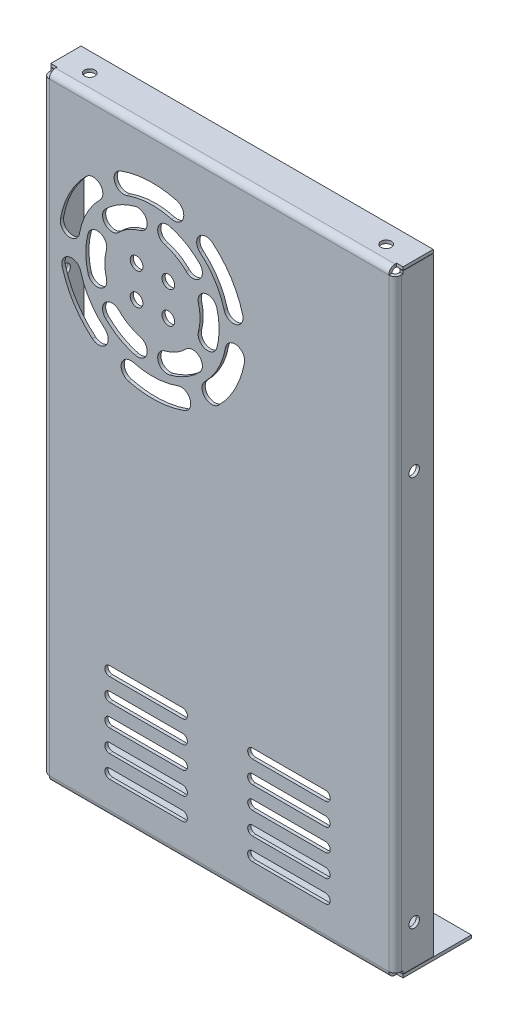
from build123d import *

# Parameters (mm, degrees)
SKETCH1_W                 = 110.95
SKETCH1_H                 = 194
EXTRUDE1_DEPTH            = 24
SHELL1_T                  = -1
SHEET_START               = -89
SHEET_METAL_1_DEPTH       = 195
SHEET_METAL_1_2_DEPTH     = 2.5
SHEET_START_2             = 103.5
SHEET_METAL_1_3_DEPTH     = 2.5
SHEET_START_3             = -87.5
SHEET_METAL_1_4_OUTLINE_W = 1
SHEET_METAL_1_4_OUTLINE_H = 21.509801
SHEET_METAL_1_4_DEPTH     = 0.1
SHEET_START_4             = 104.4
SHEET_METAL_1_5_OUTLINE_W = 1
SHEET_METAL_1_5_OUTLINE_H = 21.509801
SHEET_METAL_1_5_DEPTH     = 0.1
SHEET_START_5             = -86.5
SHEET_METAL_1_6_DEPTH     = 190
SHEET_START_6             = -53.45
SHEET_METAL_1_7_DEPTH     = 106.95
SHEET_METAL_1_8_DEPTH     = 106.95
SKETCH6_W                 = 110.95
SKETCH6_H                 = 192.9
CUT_EXTRUDE1_DEPTH        = 12
CUT_EXTRUDE2_DEPTH        = 2
LPATTERN1_COUNT           = 5
LPATTERN1_PITCH           = 7
LPATTERN1_COUNT_DIR2      = 2
LPATTERN1_PITCH_DIR2      = 45
SKETCH8_R                 = 2
CUT_EXTRUDE3_DEPTH        = 2
SKETCH11_R                = 1.65
CUT_EXTRUDE4_DEPTH        = 157.445677473
SKETCH15_R                = 1.65
CUT_EXTRUDE5_DEPTH        = 1


with BuildPart() as part:
    # Sketch1 → Extrude1 (new body)
    with BuildSketch(Plane.XY):
        with Locations((0.025, 8.5)):
            Rectangle(SKETCH1_W, SKETCH1_H)
    extrude(amount=-EXTRUDE1_DEPTH)

    # Shell1
    shell1_openings = [part.faces().sort_by_distance(p)[0] for p in [
        (0.025, 8.5, -24),
    ]]
    offset(amount=SHELL1_T, openings=shell1_openings, kind=Kind.INTERSECTION)

    # Sheet Metal 1: read off the stored shape, not the designer's step
    # Sheet Metal 1 outline → Sheet Metal 1 (cut)
    with BuildSketch(Plane(origin=(0, 0, 0), x_dir=(1, 0, 0), z_dir=(0, 1, 0)).offset(SHEET_START)):
        with BuildLine():
            Line((-55.45, 0), (-53.45, 0))
            ThreePointArc((-53.45, 0), (-54.864213562, 0.585786438), (-55.45, 2))
            Line((-55.45, 2), (-55.45, 0))
        make_face()
        with BuildLine():
            ThreePointArc((-54.45, 2), (-54.157106781, 1.292893219), (-53.45, 1))
            Line((-53.45, 1), (-53.45, 2.490199))
            Line((-53.45, 2.490199), (-54.45, 2.490199))
            Line((-54.45, 2.490199), (-54.45, 2))
        make_face()
        with BuildLine():
            ThreePointArc((55.5, 2), (54.914213562, 0.585786438), (53.5, 0))
            Line((53.5, 0), (55.5, 0))
            Line((55.5, 0), (55.5, 2))
        make_face()
        with BuildLine():
            Line((53.5, 2.490199), (53.5, 1))
            ThreePointArc((53.5, 1), (54.207106781, 1.292893219), (54.5, 2))
            Line((54.5, 2), (54.5, 2.490199))
            Line((54.5, 2.490199), (53.5, 2.490199))
        make_face()
    extrude(amount=SHEET_METAL_1_DEPTH, mode=Mode.SUBTRACT)

    # Sheet Metal 1 2 outline → Sheet Metal 1 2 (cut)
    with BuildSketch(Plane(origin=(0, 0, 0), x_dir=(1, 0, 0), z_dir=(0, 1, 0)).offset(SHEET_START)):
        with BuildLine():
            ThreePointArc((-55.45, 2), (-54.864213562, 0.585786438), (-53.45, 0))
            Line((-53.45, 0), (-53.45, 1))
            ThreePointArc((-53.45, 1), (-54.157106781, 1.292893219), (-54.45, 2))
            Line((-54.45, 2), (-54.45, 2.490199))
            Line((-54.45, 2.490199), (-55.45, 2.490199))
            Line((-55.45, 2.490199), (-55.45, 2))
        make_face()
        with BuildLine():
            Line((53.5, 1), (53.5, 0))
            ThreePointArc((53.5, 0), (54.914213562, 0.585786438), (55.5, 2))
            Line((55.5, 2), (55.5, 2.490199))
            Line((55.5, 2.490199), (54.5, 2.490199))
            Line((54.5, 2.490199), (54.5, 2))
            ThreePointArc((54.5, 2), (54.207106781, 1.292893219), (53.5, 1))
        make_face()
    extrude(amount=SHEET_METAL_1_2_DEPTH, mode=Mode.SUBTRACT)

    # Sheet Metal 1 3 outline → Sheet Metal 1 3 (cut)
    with BuildSketch(Plane(origin=(0, 0, 0), x_dir=(1, 0, 0), z_dir=(0, 1, 0)).offset(SHEET_START_2)):
        with BuildLine():
            ThreePointArc((-55.45, 2), (-54.864213562, 0.585786438), (-53.45, 0))
            Line((-53.45, 0), (-53.45, 1))
            ThreePointArc((-53.45, 1), (-54.157106781, 1.292893219), (-54.45, 2))
            Line((-54.45, 2), (-54.45, 2.490199))
            Line((-54.45, 2.490199), (-55.45, 2.490199))
            Line((-55.45, 2.490199), (-55.45, 2))
        make_face()
        with BuildLine():
            Line((53.5, 1), (53.5, 0))
            ThreePointArc((53.5, 0), (54.914213562, 0.585786438), (55.5, 2))
            Line((55.5, 2), (55.5, 2.490199))
            Line((55.5, 2.490199), (54.5, 2.490199))
            Line((54.5, 2.490199), (54.5, 2))
            ThreePointArc((54.5, 2), (54.207106781, 1.292893219), (53.5, 1))
        make_face()
    extrude(amount=SHEET_METAL_1_3_DEPTH, mode=Mode.SUBTRACT)

    # Sheet Metal 1 4 outline → Sheet Metal 1 4 (cut)
    with BuildSketch(Plane(origin=(0, 0, 0), x_dir=(1, 0, 0), z_dir=(0, 1, 0)).offset(SHEET_START_3)):
        with Locations((-54.95, 13.2450995)):
            Rectangle(SHEET_METAL_1_4_OUTLINE_W, SHEET_METAL_1_4_OUTLINE_H)
        with Locations((55, 13.2450995)):
            Rectangle(SHEET_METAL_1_4_OUTLINE_W, SHEET_METAL_1_4_OUTLINE_H)
    extrude(amount=SHEET_METAL_1_4_DEPTH, mode=Mode.SUBTRACT)

    # Sheet Metal 1 5 outline → Sheet Metal 1 5 (cut)
    with BuildSketch(Plane(origin=(0, 0, 0), x_dir=(1, 0, 0), z_dir=(0, 1, 0)).offset(SHEET_START_4)):
        with Locations((-54.95, 13.2450995)):
            Rectangle(SHEET_METAL_1_5_OUTLINE_W, SHEET_METAL_1_5_OUTLINE_H)
        with Locations((55, 13.2450995)):
            Rectangle(SHEET_METAL_1_5_OUTLINE_W, SHEET_METAL_1_5_OUTLINE_H)
    extrude(amount=SHEET_METAL_1_5_DEPTH, mode=Mode.SUBTRACT)

    # Sheet Metal 1 6 outline → Sheet Metal 1 6 (add)
    with BuildSketch(Plane(origin=(0, 0, 0), x_dir=(1, 0, 0), z_dir=(0, 1, 0)).offset(SHEET_START_5)):
        with BuildLine():
            Line((-54.45, 1), (-53.45, 1))
            ThreePointArc((-53.45, 1), (-54.157106781, 1.292893219), (-54.45, 2))
            Line((-54.45, 2), (-54.45, 1))
        make_face()
        with BuildLine():
            ThreePointArc((54.5, 2), (54.207106781, 1.292893219), (53.5, 1))
            Line((53.5, 1), (54.5, 1))
            Line((54.5, 1), (54.5, 2))
        make_face()
    extrude(amount=SHEET_METAL_1_6_DEPTH)

    # Sheet Metal 1 7 outline → Sheet Metal 1 7 (cut)
    with BuildSketch(Plane.YZ.offset(SHEET_START_6)):
        with BuildLine():
            Line((105.5, 0), (103.5, 0))
            ThreePointArc((103.5, 0), (104.914213562, -0.585786438), (105.5, -2))
            Line((105.5, -2), (105.5, 0))
        make_face()
        with BuildLine():
            ThreePointArc((-88.5, -2), (-87.914213562, -0.585786438), (-86.5, 0))
            Line((-86.5, 0), (-88.5, 0))
            Line((-88.5, 0), (-88.5, -2))
        make_face()
    extrude(amount=SHEET_METAL_1_7_DEPTH, mode=Mode.SUBTRACT)

    # Sheet Metal 1 8 outline → Sheet Metal 1 8 (add)
    with BuildSketch(Plane.YZ.offset(SHEET_START_6)):
        with BuildLine():
            Line((104.5, -1), (103.5, -1))
            ThreePointArc((103.5, -1), (104.207106781, -1.292893219), (104.5, -2))
            Line((104.5, -2), (104.5, -1))
        make_face()
        with BuildLine():
            ThreePointArc((-87.5, -2), (-87.207106781, -1.292893219), (-86.5, -1))
            Line((-86.5, -1), (-87.5, -1))
            Line((-87.5, -1), (-87.5, -2))
        make_face()
    extrude(amount=SHEET_METAL_1_8_DEPTH)

    # Sketch6 → Cut-Extrude1 (cut)
    with BuildSketch(Plane(origin=(0, 0, -24), x_dir=(-1, 0, 0), z_dir=(0, 0, -1))):
        with Locations((-0.025, 9.05)):
            Rectangle(SKETCH6_W, SKETCH6_H)
    extrude(amount=-CUT_EXTRUDE1_DEPTH, mode=Mode.SUBTRACT)

    # Sketch7 → Cut-Extrude2 (cut)
    with BuildSketch(Plane(origin=(0, 0, -1), x_dir=(-1, 0, 0), z_dir=(0, 0, -1))):
        with BuildLine():
            Line((34.45, -78), (11.45, -78))
            ThreePointArc((11.45, -78), (9.95, -76.5), (11.45, -75))
            Line((11.45, -75), (34.45, -75))
            ThreePointArc((34.45, -75), (35.95, -76.5), (34.45, -78))
        make_face()
    cut_extrude2 = extrude(amount=-CUT_EXTRUDE2_DEPTH, mode=Mode.SUBTRACT)

    # LPattern1: Cut-Extrude2 5 × 2
    with Locations(*[(j * LPATTERN1_PITCH_DIR2, i * LPATTERN1_PITCH, 0) for i in range(LPATTERN1_COUNT) for j in range(LPATTERN1_COUNT_DIR2) if (i, j) != (0, 0)]):
        add(cut_extrude2, mode=Mode.SUBTRACT)

    # Sketch8 → Cut-Extrude3 (cut)
    with BuildSketch(Plane.XY):
        with BuildLine():
            ThreePointArc((-13.332195344, 90.430034016), (-22.233846681, 91.404923391), (-31.01665734, 89.657913731))
            ThreePointArc((-31.01665734, 89.657913731), (-32.831890049, 85.765134624), (-28.939110942, 83.949901915))
            ThreePointArc((-28.939110942, 83.949901915), (-21.968887723, 85.336365517), (-14.904350042, 84.56267281))
            ThreePointArc((-14.904350042, 84.56267281), (-11.18459209, 86.710276065), (-13.332195344, 90.430034016))
        make_face()
        with BuildLine():
            ThreePointArc((-26.385199947, 82.284442352), (-31.45, 80.186533479), (-35.799242405, 76.849242405))
            ThreePointArc((-35.799242405, 76.849242405), (-35.799242405, 72.606601718), (-31.556601718, 72.606601718))
            ThreePointArc((-31.556601718, 72.606601718), (-28.45, 74.990381057), (-24.832285677, 76.488887394))
            ThreePointArc((-24.832285677, 76.488887394), (-22.710965333, 80.163122009), (-26.385199947, 82.284442352))
        make_face()
        with BuildLine():
            ThreePointArc((-6.100757595, 76.849242405), (-10.45, 80.186533479), (-15.514800053, 82.284442352))
            ThreePointArc((-15.514800053, 82.284442352), (-19.189034667, 80.163122009), (-17.067714323, 76.488887394))
            ThreePointArc((-17.067714323, 76.488887394), (-13.45, 74.990381057), (-10.343398282, 72.606601718))
            ThreePointArc((-10.343398282, 72.606601718), (-6.100757595, 72.606601718), (-6.100757595, 76.849242405))
        make_face()
        with BuildLine():
            ThreePointArc((7.480034016, 69.617804656), (3.873487312, 77.814305536), (-2.030872763, 84.546937853))
            ThreePointArc((-2.030872763, 84.546937853), (-6.309734716, 84.172585939), (-5.935382802, 79.893723987))
            ThreePointArc((-5.935382802, 79.893723987), (-1.249558492, 74.55056541), (1.61267281, 68.045649958))
            ThreePointArc((1.61267281, 68.045649958), (5.332430762, 65.898046704), (7.480034016, 69.617804656))
        make_face()
        with BuildLine():
            ThreePointArc((-0.665557648, 56.564800053), (0.05, 62), (-0.665557648, 67.435199947))
            ThreePointArc((-0.665557648, 67.435199947), (-4.339792262, 69.556520291), (-6.461112606, 65.882285677))
            ThreePointArc((-6.461112606, 65.882285677), (-5.95, 62), (-6.461112606, 58.117714323))
            ThreePointArc((-6.461112606, 58.117714323), (-4.339792262, 54.443479709), (-0.665557648, 56.564800053))
        make_face()
        with BuildLine():
            ThreePointArc((-0.137770639, 41.187770639), (5.157333994, 48.409382145), (8.035784577, 56.889024122))
            ThreePointArc((8.035784577, 56.889024122), (5.572155333, 60.407451315), (2.05372814, 57.943822072))
            ThreePointArc((2.05372814, 57.943822072), (-0.230670769, 51.214199893), (-4.432977149, 45.482977149))
            ThreePointArc((-4.432977149, 45.482977149), (-4.432977149, 41.187770639), (-0.137770639, 41.187770639))
        make_face()
        with BuildLine():
            ThreePointArc((-15.514800053, 41.715557648), (-10.45, 43.813466521), (-6.100757595, 47.150757595))
            ThreePointArc((-6.100757595, 47.150757595), (-6.100757595, 51.393398282), (-10.343398282, 51.393398282))
            ThreePointArc((-10.343398282, 51.393398282), (-13.45, 49.009618943), (-17.067714323, 47.511112606))
            ThreePointArc((-17.067714323, 47.511112606), (-19.189034667, 43.836877991), (-15.514800053, 41.715557648))
        make_face()
        with BuildLine():
            ThreePointArc((-41.762229361, 82.812229361), (-47.057333994, 75.590617855), (-49.935784577, 67.110975878))
            ThreePointArc((-49.935784577, 67.110975878), (-47.472155333, 63.592548685), (-43.95372814, 66.056177928))
            ThreePointArc((-43.95372814, 66.056177928), (-41.669329231, 72.785800107), (-37.467022851, 78.517022851))
            ThreePointArc((-37.467022851, 78.517022851), (-37.467022851, 82.812229361), (-41.762229361, 82.812229361))
        make_face()
        with BuildLine():
            ThreePointArc((-41.234442352, 67.435199947), (-41.95, 62), (-41.234442352, 56.564800053))
            ThreePointArc((-41.234442352, 56.564800053), (-37.560207738, 54.443479709), (-35.438887394, 58.117714323))
            ThreePointArc((-35.438887394, 58.117714323), (-35.95, 62), (-35.438887394, 65.882285677))
            ThreePointArc((-35.438887394, 65.882285677), (-37.560207738, 69.556520291), (-41.234442352, 67.435199947))
        make_face()
        with BuildLine():
            ThreePointArc((-35.799242405, 47.150757595), (-31.45, 43.813466521), (-26.385199947, 41.715557648))
            ThreePointArc((-26.385199947, 41.715557648), (-22.710965333, 43.836877991), (-24.832285677, 47.511112606))
            ThreePointArc((-24.832285677, 47.511112606), (-28.45, 49.009618943), (-31.556601718, 51.393398282))
            ThreePointArc((-31.556601718, 51.393398282), (-35.799242405, 51.393398282), (-35.799242405, 47.150757595))
        make_face()
        with BuildLine():
            ThreePointArc((-28.567804656, 33.569965984), (-19.666153319, 32.595076609), (-10.88334266, 34.342086269))
            ThreePointArc((-10.88334266, 34.342086269), (-9.068109951, 38.234865376), (-12.960889058, 40.050098085))
            ThreePointArc((-12.960889058, 40.050098085), (-19.931112277, 38.663634483), (-26.995649958, 39.43732719))
            ThreePointArc((-26.995649958, 39.43732719), (-30.71540791, 37.289723935), (-28.567804656, 33.569965984))
        make_face()
        with BuildLine():
            ThreePointArc((-49.380034016, 54.382195344), (-45.773487312, 46.185694464), (-39.869127237, 39.453062147))
            ThreePointArc((-39.869127237, 39.453062147), (-35.590265284, 39.827414061), (-35.964617198, 44.106276013))
            ThreePointArc((-35.964617198, 44.106276013), (-40.650441508, 49.44943459), (-43.51267281, 55.954350042))
            ThreePointArc((-43.51267281, 55.954350042), (-47.232430762, 58.101953296), (-49.380034016, 54.382195344))
        make_face()
        with Locations((-15.95, 67)):
            Circle(SKETCH8_R)
        with Locations((-25.95, 67)):
            Circle(SKETCH8_R)
        with Locations((-25.95, 57)):
            Circle(SKETCH8_R)
        with Locations((-15.95, 57)):
            Circle(SKETCH8_R)
    extrude(amount=-CUT_EXTRUDE3_DEPTH, mode=Mode.SUBTRACT)

    # Sketch11 → Cut-Extrude4 (cut, through all)
    with BuildSketch(Plane.ZY.offset(57.5)):
        with Locations((-6, 48)):
            Circle(SKETCH11_R)
        with Locations((-6, -75)):
            Circle(SKETCH11_R)
    extrude(amount=-CUT_EXTRUDE4_DEPTH, mode=Mode.SUBTRACT)

    # Sketch15 → Cut-Extrude5 (cut)
    with BuildSketch(Plane.XZ.offset(-105.5)):
        with Locations(Location((46.693467147, -5.975267138, 0), (0, 0, 270))):
            Circle(SKETCH15_R)
        with Locations(Location((-46.693467147, -5.975267138, 0), (0, 0, 270))):
            Circle(SKETCH15_R)
    extrude(amount=CUT_EXTRUDE5_DEPTH, mode=Mode.SUBTRACT)


solid = part.part
